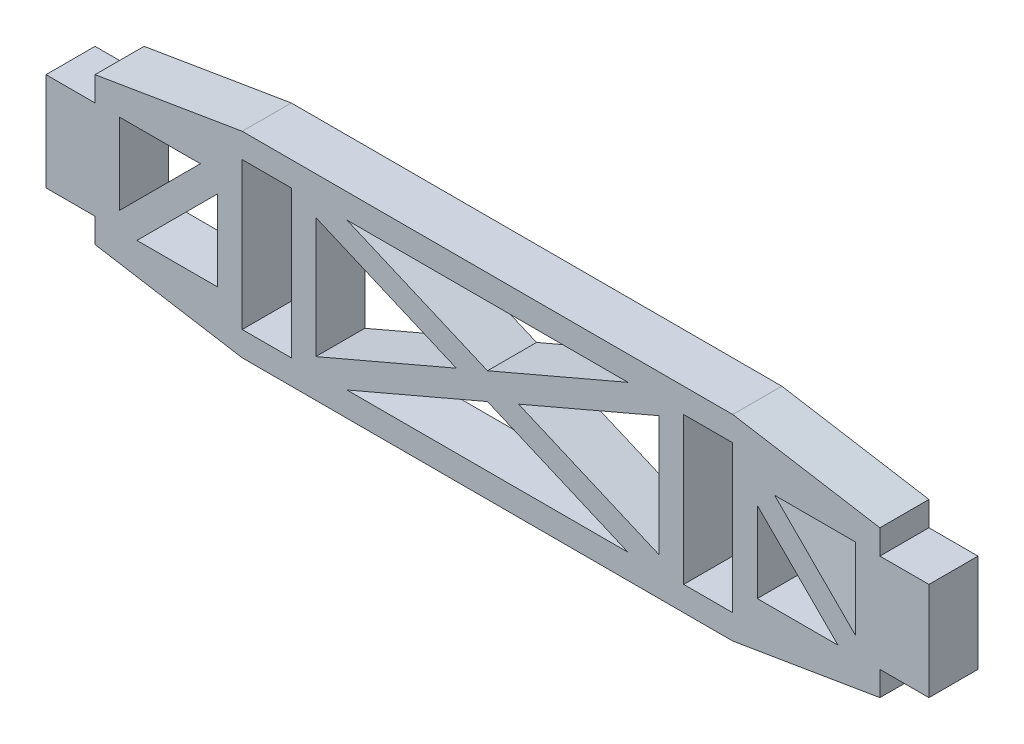
from build123d import *

# Parameters (mm, degrees)
SKETCH1_W           = 6.35
SKETCH1_H           = 19.05
BOSS_EXTRUDE1_DEPTH = 3.175
CUT_EXTRUDE1_DEPTH  = 59.887477446


with BuildPart() as part:
    # Sketch1 → Boss-Extrude1 (new, symmetric)
    with BuildSketch(Plane.XY):
        Polygon((-50.8, -9.525), (-50.8, -6.35), (-57.15, -6.35), (-57.15, 6.35), (-50.8, 6.35), (-50.8, 9.525), (-31.75, 12.7), (31.75, 12.7), (50.8, 9.525), (50.8, 6.35), (57.15, 6.35), (57.15, -6.35), (50.8, -6.35), (50.8, -9.525), (31.75, -12.7), (-31.75, -12.7), align=None)
        with Locations((-28.575, 0)):
            Rectangle(SKETCH1_W, SKETCH1_H, mode=Mode.SUBTRACT)
        with Locations((28.575, 0)):
            Rectangle(SKETCH1_W, SKETCH1_H, mode=Mode.SUBTRACT)
    extrude(amount=BOSS_EXTRUDE1_DEPTH, both=True)

    # Sketch2 → Cut-Extrude1 (cut, through all)
    with BuildSketch(Plane.XY.offset(3.175)):
        Polygon((-37.17006403, 6.35), (-47.625, 6.35), (-47.625, -4.10493597), align=None)
        Polygon((-34.925, 4.10493597), (-45.37993597, -6.35), (-34.925, -6.35), align=None)
        Polygon((-18.194986731, -9.525), (18.194986731, -9.525), (0, -1.727148544), align=None)
        Polygon((4.030013269, 0), (22.225, -7.797851456), (22.225, 7.797851456), align=None)
        Polygon((-22.225, -7.797851456), (-4.030013269, 0), (-22.225, 7.797851456), align=None)
        Polygon((-18.194986731, 9.525), (0, 1.727148544), (18.194986731, 9.525), align=None)
        Polygon((47.625, 6.35), (37.17006403, 6.35), (47.625, -4.10493597), align=None)
        Polygon((45.37993597, -6.35), (34.925, 4.10493597), (34.925, -6.35), align=None)
    extrude(amount=-CUT_EXTRUDE1_DEPTH, mode=Mode.SUBTRACT)


solid = part.part
